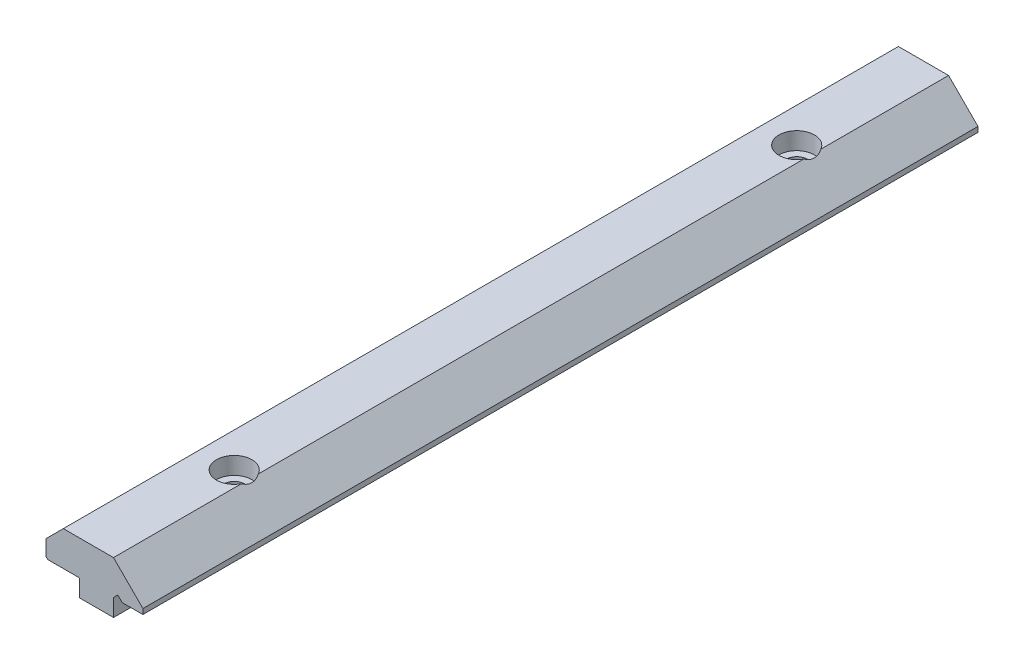
from build123d import *

# Parameters (mm, degrees)
EXTRUDE_1_DEPTH          = 96.5
CHAMFER_1_SIZE           = 1
CHAMFER_2_SIZE           = 1
CUT_EXTRUDE_1_DEPTH      = 97.93327602
CUT_EXTRUDE_1_DEPTH_BACK = 10
SKETCH_2_R               = 1.2
SKETCH_2_3_R             = 2.05
CUT_EXTRUDE_2_DEPTH      = 2
CHAMFER_3_SIZE           = 2
SKETCH_3_W               = 1.8
SKETCH_3_H               = 7.4
CUT_EXTRUDE_3_DEPTH      = 1.9
CHAMFER_4_SIZE           = 0.2
CHAMFER_5_SIZE           = 0.6
SKETCH_4_W               = 3.9
SKETCH_4_H               = 7.9
EXTRUDE_2_DEPTH          = 2
CHAMFER_6_SIZE           = 0.4
EXTRUDE_3_DEPTH          = 96.5


with BuildPart() as part:
    # 草图1 → 凸台-拉伸1 (new body)
    with BuildSketch(Plane.XY):
        Polygon((0, 0), (7, 0), (7, 4), (0, 4), (-1.8, 4), (-1.8, -1.9), (0, -1.9), align=None)
    extrude(amount=-EXTRUDE_1_DEPTH)

    # 倒角1
    chamfer_1_edges = [part.edges().sort_by_distance(p)[0] for p in [
        (7, 0, -48.25),
    ]]
    chamfer(chamfer_1_edges, length=CHAMFER_1_SIZE)

    # 倒角2
    chamfer_2_edges = [part.edges().sort_by_distance(p)[0] for p in [
        (7, 4, -48.25),
    ]]
    chamfer(chamfer_2_edges, length=CHAMFER_2_SIZE)

    # 草图2 → 切除-拉伸1 (cut, two sides: drawn at the far end of the back side and taken through both)
    with BuildSketch(Plane(origin=(0, 4, 0), x_dir=(1, 0, 0), z_dir=(0, 1, 0)).offset(-CUT_EXTRUDE_1_DEPTH_BACK)):
        with Locations(Location((4.2, 80.75, 0), (0, 0, 90))):
            Circle(SKETCH_2_R)
        with Locations(Location((4.2, 15.75, 0), (0, 0, 90))):
            Circle(SKETCH_2_R)
    extrude(amount=CUT_EXTRUDE_1_DEPTH + CUT_EXTRUDE_1_DEPTH_BACK, mode=Mode.SUBTRACT)

    # 草图2<3> → 切除-拉伸2 (cut)
    with BuildSketch(Plane(origin=(0, 4, 0), x_dir=(1, 0, 0), z_dir=(0, 1, 0))):
        with Locations(Location((4.2, 80.75, 0), (0, 0, 270))):
            Circle(SKETCH_2_3_R)
        with Locations(Location((4.2, 15.75, 0), (0, 0, 270))):
            Circle(SKETCH_2_3_R)
    extrude(amount=-CUT_EXTRUDE_2_DEPTH, mode=Mode.SUBTRACT)

    # 倒角3
    chamfer_3_edges = [part.edges().sort_by_distance(p)[0] for p in [
        (-1.8, 4, -48.25),
    ]]
    chamfer(chamfer_3_edges, length=CHAMFER_3_SIZE)

    # 草图3 → 切除-拉伸3 (cut)
    with BuildSketch(Plane.XZ.offset(1.9)):
        with Locations((-0.9, -92.8)):
            Rectangle(SKETCH_3_W, SKETCH_3_H)
        with Locations((-0.9, -3.7)):
            Rectangle(SKETCH_3_W, SKETCH_3_H)
    extrude(amount=-CUT_EXTRUDE_3_DEPTH, mode=Mode.SUBTRACT)

    # 倒角4
    chamfer_4_edges = [part.edges().sort_by_distance(p)[0] for p in [
        (-1.8, -1.9, -48.25),
        (0, -1.9, -48.25),
        (-1.8, -0.95, -89.1),
        (0, -0.95, -89.1),
        (-1.8, 0, -92.8),
        (-1.8, -0.95, -7.4),
        (0, -0.95, -7.4),
        (-1.8, 0, -3.7),
    ]]
    chamfer(chamfer_4_edges, length=CHAMFER_4_SIZE)

    # 倒角5
    # the kernel refuses this chamfer: 0.6 mm, written as the material it takes off along each edge
    with BuildSketch(Plane(origin=(1.343009793, -1.9, -89.1), x_dir=(0, 0.9996219169112965, -0.027495876610595982), z_dir=(-1, 0, 0))) as chamfer_5_piece_1:
        Polygon((CHAMFER_5_SIZE * 0.999621916911, -CHAMFER_5_SIZE * 0.0274958766106), (-CHAMFER_5_SIZE * 0.0274958766106, -CHAMFER_5_SIZE * 0.999621916911), (0, 0), align=None)
    extrude(amount=4.486019586, mode=Mode.SUBTRACT)
    with BuildSketch(Plane(origin=(1.343009793, -1.9, -7.4), x_dir=(0, 0.9996219169112968, 0.027495876610585925), z_dir=(-1, 0, 0))) as chamfer_5_piece_2:
        Polygon((CHAMFER_5_SIZE * 0.999621916911, CHAMFER_5_SIZE * 0.0274958766106), (-CHAMFER_5_SIZE * 0.0274958766106, CHAMFER_5_SIZE * 0.999621916911), (0, 0), align=None)
    extrude(amount=4.486019586, mode=Mode.SUBTRACT)

    # 草图4 → 凸台-拉伸2 (add)
    with BuildSketch(Plane.XZ):
        with Locations((4.05, -92.55)):
            Rectangle(SKETCH_4_W, SKETCH_4_H)
        with Locations((4.05, -3.95)):
            Rectangle(SKETCH_4_W, SKETCH_4_H)
    extrude(amount=EXTRUDE_2_DEPTH)

    # 倒角6
    chamfer_6_edges = [part.edges().sort_by_distance(p)[0] for p in [
        (6, -1, -88.6),
        (6, -1, -7.9),
    ]]
    chamfer(chamfer_6_edges, length=CHAMFER_6_SIZE)

    # 草图5 → 凸台-拉伸3 (add)
    with BuildSketch(Plane.XY):
        Polygon((7, 3), (9.4, 0.6), (9.4, 0), (7, 0), (6.5, 0.5), (7, 1), align=None)
    extrude(amount=-EXTRUDE_3_DEPTH)


solid = part.part
